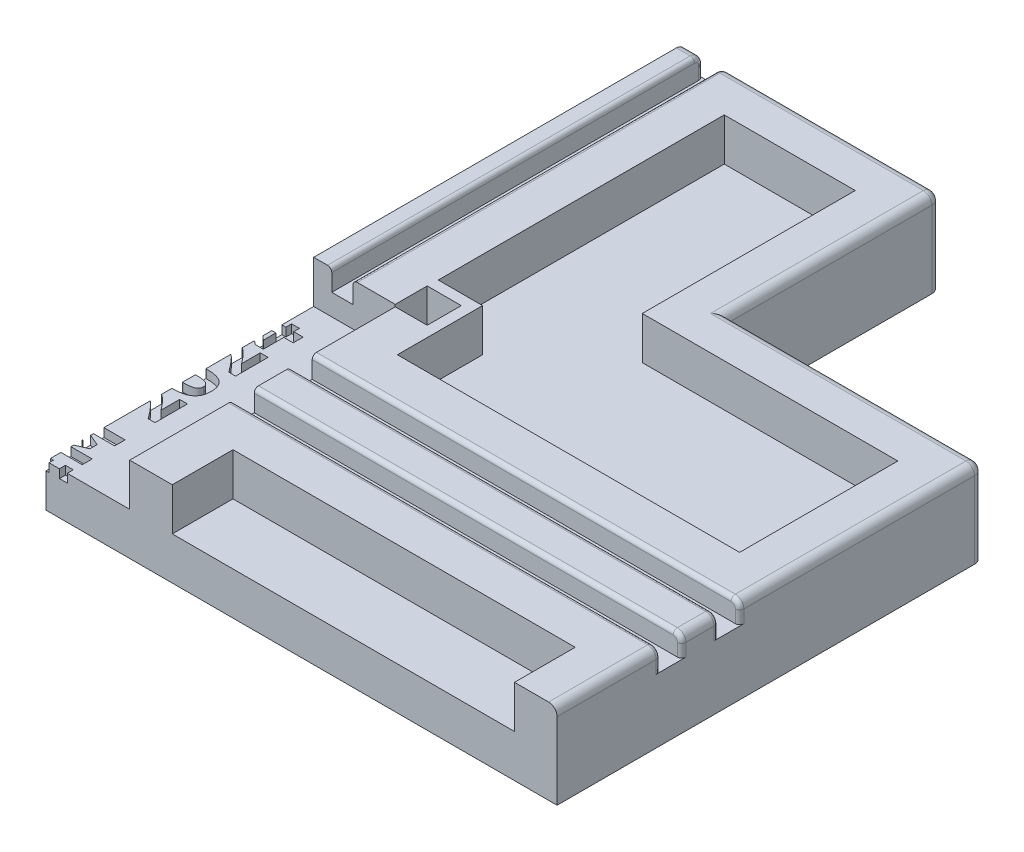
from build123d import *

# Parameters (mm, degrees)
SKETCH1_W                                  = 240
SKETCH1_H                                  = 200
BOSS_EXTRUDE1_DEPTH                        = 20
SKETCH7_W                                  = 120
SKETCH7_H                                  = 50
BOSS_EXTRUDE6_DEPTH                        = 20
FILLET1_R                                  = 2
SKETCH2_W                                  = 39.3
SKETCH2_H                                  = 125.7
CUT_EXTRUDE1_DEPTH                         = 10
CUT_EXTRUDE3_DEPTH                         = 5
MIRROR4_AT_THE_SECOND_PLANE_COPY_1_DEPTH   = 5
SKETCH11_W                                 = 104.748042719
SKETCH11_H                                 = 5
CUT_EXTRUDE4_DEPTH                         = 5
MIRROR6_AT_THE_SECOND_PLANE_COPY_1_SKETC_W = 104.748042719
MIRROR6_AT_THE_SECOND_PLANE_COPY_1_SKETC_H = 5
MIRROR6_AT_THE_SECOND_PLANE_COPY_1_DEPTH   = 5
SHELL1_START                               = 10
SHELL1_OUTLINE_W                           = 80.35
SHELL1_OUTLINE_H                           = 28.5
SHELL1_DEPTH                               = 10
FILLET3_R                                  = 1
SKETCH13_W                                 = 7.252545243
SKETCH13_H                                 = 2.335565418
SKETCH13_W_2                               = 1.720942939
SKETCH13_H_2                               = 2.581414408
CUT_EXTRUDE5_DEPTH                         = 2
CUT_EXTRUDE6_DEPTH                         = 10
MIRROR7_AT_THE_SECOND_PLANE_COPY_1_DEPTH   = 10
SKETCH15_W                                 = 266.75178719
SKETCH15_H                                 = 32.364197877
CUT_EXTRUDE7_DEPTH                         = 194.132079158
SKETCH16_W                                 = 159.450564736
SKETCH16_H                                 = 27.022841001
CUT_EXTRUDE8_DEPTH                         = 194.132079158


# Read off the part's stored shape, not the designer's step: Shell1
with BuildPart() as part:
    # Sketch1 → Boss-Extrude1 (new body)
    with BuildSketch(Plane(origin=(0, 0, 0), x_dir=(1, 0, 0), z_dir=(0, 1, 0))):
        Rectangle(SKETCH1_W, SKETCH1_H)
    extrude(amount=BOSS_EXTRUDE1_DEPTH)

    # Sketch7 → Boss-Extrude6 (add)
    with BuildSketch(Plane(origin=(0, 0, 0), x_dir=(1, 0, 0), z_dir=(0, 1, 0))):
        with Locations((0, 125)):
            Rectangle(SKETCH7_W, SKETCH7_H)
        with Locations((0, -125)):
            Rectangle(SKETCH7_W, SKETCH7_H)
    extrude(amount=BOSS_EXTRUDE6_DEPTH)

    # Fillet1
    fillet1_edges = [part.edges().sort_by_distance(p)[0] for p in [
        (-120, 20, 0),
        (90, 20, 100),
        (-90, 20, 100),
        (-60, 10, 150),
        (60, 10, 150),
        (-60, 20, 125),
        (0, 20, 150),
        (60, 20, 125),
        (-90, 20, -100),
        (60, 20, -125),
        (0, 20, -150),
        (60, 10, -150),
        (-60, 10, -150),
        (-60, 20, -125),
        (120, 20, 0),
        (120, 10, 100),
        (-120, 10, 100),
        (-120, 10, -100),
        (120, 10, -100),
        (90, 20, -100),
    ]]
    fillet(fillet1_edges, radius=FILLET1_R)

    # Sketch2 → Cut-Extrude1 (cut)
    with BuildSketch(Plane(origin=(0, 20, 0), x_dir=(1, 0, 0), z_dir=(0, 1, 0))):
        Rectangle(SKETCH2_W, SKETCH2_H)
    extrude(amount=-CUT_EXTRUDE1_DEPTH, mode=Mode.SUBTRACT)

    # Sketch10 → Cut-Extrude3 (cut)
    with BuildSketch(Plane(origin=(0, 20, 0), x_dir=(1, 0, 0), z_dir=(0, 1, 0))):
        Polygon((-9.25, -40.5), (-9.25, -33.162899401), (-4.25, -33.162899401), (-4.25, -40.5), (-4.25, -156.832928994), (-9.25, -156.832928994), align=None)
    cut_extrude3 = extrude(amount=-CUT_EXTRUDE3_DEPTH, mode=Mode.SUBTRACT)

    # Mirror4: Cut-Extrude3 across plane
    add(cut_extrude3.mirror(Plane(origin=(0, 0, 0), x_dir=(0, 0, 1), z_dir=(1, 0, 0))), mode=Mode.SUBTRACT)

    # Mirror4 at the second plane: Cut-Extrude3 across plane
    add(cut_extrude3.mirror(Plane.XY), mode=Mode.SUBTRACT)

    # Mirror4 at the second plane copy 1 sketc → Mirror4 at the second plane copy 1 (cut)
    with BuildSketch(Plane(origin=(0, 20, 0), x_dir=(-1, 0, 0), z_dir=(0, 1, 0))):
        Polygon((-9.25, -40.5), (-9.25, -33.162899401), (-4.25, -33.162899401), (-4.25, -40.5), (-4.25, -156.832928994), (-9.25, -156.832928994), align=None)
    extrude(amount=-MIRROR4_AT_THE_SECOND_PLANE_COPY_1_DEPTH, mode=Mode.SUBTRACT)

    # Sketch11 → Cut-Extrude4 (cut)
    with BuildSketch(Plane(origin=(0, 20, 0), x_dir=(1, 0, 0), z_dir=(0, 1, 0))):
        with Locations((-72.024021359, 26.75)):
            Rectangle(SKETCH11_W, SKETCH11_H)
        with Locations((-72.024021359, 40.35)):
            Rectangle(SKETCH11_W, SKETCH11_H)
    cut_extrude4 = extrude(amount=-CUT_EXTRUDE4_DEPTH, mode=Mode.SUBTRACT)

    # Mirror6: Cut-Extrude4 across plane
    add(cut_extrude4.mirror(Plane.XY), mode=Mode.SUBTRACT)

    # Mirror6 at the second plane: Cut-Extrude4 across plane
    add(cut_extrude4.mirror(Plane(origin=(0, 0, 0), x_dir=(0, 0, 1), z_dir=(1, 0, 0))), mode=Mode.SUBTRACT)

    # Mirror6 at the second plane copy 1 sketc → Mirror6 at the second plane copy 1 (cut)
    with BuildSketch(Plane(origin=(0, 20, 0), x_dir=(-1, 0, 0), z_dir=(0, 1, 0))):
        with Locations((-72.024021359, 26.75)):
            Rectangle(MIRROR6_AT_THE_SECOND_PLANE_COPY_1_SKETC_W, MIRROR6_AT_THE_SECOND_PLANE_COPY_1_SKETC_H)
        with Locations((-72.024021359, 40.35)):
            Rectangle(MIRROR6_AT_THE_SECOND_PLANE_COPY_1_SKETC_W, MIRROR6_AT_THE_SECOND_PLANE_COPY_1_SKETC_H)
    extrude(amount=-MIRROR6_AT_THE_SECOND_PLANE_COPY_1_DEPTH, mode=Mode.SUBTRACT)

    # Shell1 outline → Shell1 (cut)
    with BuildSketch(Plane(origin=(0, 0, 0), x_dir=(1, 0, 0), z_dir=(0, 1, 0)).offset(SHELL1_START)):
        Polygon((-29.65, 72.85), (-19.25, 72.85), (-19.25, 140), (-50, 140), (-50, 90), (-110, 90), (-110, 52.85), (-29.65, 52.85), align=None)
        Polygon((19.25, 72.85), (29.65, 72.85), (29.65, 52.85), (110, 52.85), (110, 90), (50, 90), (50, 140), (19.25, 140), align=None)
        Polygon((-110, -52.85), (-110, -90), (-50, -90), (-50, -140), (-19.25, -140), (-19.25, -72.85), (-29.65, -72.85), (-29.65, -52.85), align=None)
        with Locations((-69.825, 0)):
            Rectangle(SHELL1_OUTLINE_W, SHELL1_OUTLINE_H)
        Polygon((29.65, -72.85), (19.25, -72.85), (19.25, -140), (50, -140), (50, -90), (110, -90), (110, -52.85), (29.65, -52.85), align=None)
        with Locations((69.825, 0)):
            Rectangle(SHELL1_OUTLINE_W, SHELL1_OUTLINE_H)
    extrude(amount=SHELL1_DEPTH, mode=Mode.SUBTRACT)

    # Fillet3
    fillet3_edges = [part.edges().sort_by_distance(p)[0] for p in [
        (-4.25, 16.5, 150),
        (-4.25, 19.414213562, 149.414213562),
        (-9.25, 16.5, 150),
        (-9.25, 19.414213562, 149.414213562),
        (-4.25, 20, 105.425),
        (-9.25, 20, 105.425),
        (-9.25, 19.414213562, -149.414213562),
        (-9.25, 16.5, -150),
        (-9.25, 20, -105.425),
        (-4.25, 16.5, -150),
        (-4.25, 19.414213562, -149.414213562),
        (-4.25, 20, -105.425),
        (9.25, 16.5, 150),
        (9.25, 20, 105.425),
        (9.25, 19.414213562, 149.414213562),
        (4.25, 16.5, 150),
        (4.25, 19.414213562, 149.414213562),
        (4.25, 20, 105.425),
        (4.25, 16.5, -150),
        (4.25, 19.414213562, -149.414213562),
        (9.25, 19.414213562, -149.414213562),
        (9.25, 16.5, -150),
        (4.25, 20, -105.425),
        (9.25, 20, -105.425),
        (-120, 16.5, -24.25),
        (-120, 16.5, -29.25),
        (-119.414213562, 19.414213562, -24.25),
        (-119.414213562, 19.414213562, -29.25),
        (-68.825, 20, -24.25),
        (-68.825, 20, -29.25),
        (-120, 16.5, -37.85),
        (-120, 16.5, -42.85),
        (-68.825, 20, -37.85),
        (-68.825, 20, -42.85),
        (-119.414213562, 19.414213562, -37.85),
        (-119.414213562, 19.414213562, -42.85),
        (68.825, 20, -29.25),
        (119.414213562, 19.414213562, -29.25),
        (119.414213562, 19.414213562, -24.25),
        (68.825, 20, -24.25),
        (120, 16.5, -29.25),
        (120, 16.5, -24.25),
        (68.825, 20, -42.85),
        (119.414213562, 19.414213562, -42.85),
        (119.414213562, 19.414213562, -37.85),
        (68.825, 20, -37.85),
        (120, 16.5, -42.85),
        (120, 16.5, -37.85),
        (-120, 16.5, 29.25),
        (-120, 16.5, 24.25),
        (-68.825, 20, 29.25),
        (-119.414213562, 19.414213562, 29.25),
        (-119.414213562, 19.414213562, 24.25),
        (-68.825, 20, 24.25),
        (-120, 16.5, 42.85),
        (-120, 16.5, 37.85),
        (-68.825, 20, 42.85),
        (-119.414213562, 19.414213562, 42.85),
        (-119.414213562, 19.414213562, 37.85),
        (-68.825, 20, 37.85),
        (120, 16.5, 24.25),
        (120, 16.5, 29.25),
        (119.414213562, 19.414213562, 24.25),
        (119.414213562, 19.414213562, 29.25),
        (68.825, 20, 24.25),
        (68.825, 20, 29.25),
        (120, 16.5, 37.85),
        (120, 16.5, 42.85),
        (68.825, 20, 37.85),
        (68.825, 20, 42.85),
        (119.414213562, 19.414213562, 37.85),
        (119.414213562, 19.414213562, 42.85),
    ]]
    fillet(fillet3_edges, radius=FILLET3_R)

    # Sketch13 → Cut-Extrude5 (cut)
    # profile 1 of 12: a face of its own
    with BuildSketch(Plane(origin=(0, 10, 0), x_dir=(1, 0, 0), z_dir=(0, 1, 0))):
        Polygon((2.787359078, 56.729654742), (2.787359078, 55.37748529), (5, 55.37748529), (5, 53.041919872), (2.787359078, 53.041919872), (2.787359078, 48.247864542), (0.880108701, 48.247864542), (-4.711035156, 52.886343558), (-4.711035156, 55.37748529), (0.943491644, 55.37748529), (0.943491644, 56.729654742), align=None)
        Polygon((0.943491644, 53.041919872), (-2.596349692, 53.041919872), (0.943491644, 50.110938929), align=None, mode=Mode.SUBTRACT)
    # profile 2 of 12: a face of its own
    with BuildSketch(Plane(origin=(0, 10, 0), x_dir=(1, 0, 0), z_dir=(0, 1, 0))):
        with BuildLine():
            Line((5, 47.141544081), (5, 39.520225351))
            Line((5, 39.520225351), (3.409664338, 39.520225351))
            add(Edge.make_bspline(
                [(3.409664338, 39.520225351), (3.190599668, 39.81675512), (2.747057383, 40.417141716), (2.167094132, 41.14339637), (1.704390868, 41.703253096), (1.381972101, 42.083056551), (1.083256561, 42.417759603), (0.887687077, 42.622007507), (0.79559811, 42.718182933)],
                knots=[0, 0, 0, 0, 1.605452287, 3.25057426, 4.046675402, 4.768563423, 5.420146126, 6, 6, 6, 6], degree=3))
            add(Edge.make_bspline(
                [(0.79559811, 42.718182933), (0.732570292, 42.782561984), (0.609352585, 42.908421315), (0.423765416, 43.085974145), (0.244476812, 43.249198615), (0.074088064, 43.400664381), (-0.092796487, 43.534082219), (-0.252790737, 43.654099684), (-0.406497488, 43.759962438), (-0.599845109, 43.881290453), (-0.837875375, 44.00401532), (-1.125540586, 44.112139625), (-1.412736444, 44.178491494), (-1.604945873, 44.187117789), (-1.699385013, 44.191356186)],
                knots=[0, 0, 0, 0, 1.090093853, 2.131104457, 3.107135244, 4.023908394, 4.888948297, 5.691514549, 6.4435893, 7.146498757, 8.452673016, 9.675803408, 10.85804184, 12, 12, 12, 12], degree=3))
            add(Edge.make_bspline(
                [(-1.699385013, 44.191356186), (-1.754483363, 44.189605987), (-1.861179083, 44.186216799), (-2.017224671, 44.167846758), (-2.162681909, 44.132103765), (-2.300488192, 44.087839319), (-2.42643972, 44.024206924), (-2.544199113, 43.950411254), (-2.650531499, 43.859818439), (-2.749307162, 43.758726543), (-2.834556733, 43.642742478), (-2.911599654, 43.517157005), (-2.971430142, 43.377241787), (-3.024398474, 43.226819474), (-3.063653395, 43.063897589), (-3.092633036, 42.889340485), (-3.109905835, 42.703165878), (-3.111960528, 42.574807759), (-3.113016713, 42.508827152)],
                knots=[0, 0, 0, 0, 1.058578686, 2.049894692, 3.010224385, 3.931750511, 4.822578239, 5.71281177, 6.594427321, 7.498813824, 8.420995957, 9.353043897, 10.321837571, 11.3367408, 12.413304787, 13.535187771, 14.732999458, 16, 16, 16, 16], degree=3))
            add(Edge.make_bspline(
                [(-3.113016713, 42.508827152), (-3.110052719, 42.405568465), (-3.104041103, 42.196137688), (-3.053985994, 41.878413923), (-2.980602684, 41.552282773), (-2.873221808, 41.222921491), (-2.74714341, 40.895094854), (-2.596251992, 40.578640505), (-2.438170844, 40.269132893), (-2.314289691, 40.074405983), (-2.252545243, 39.977350819)],
                knots=[0, 0, 0, 0, 0.914703558, 1.855215137, 2.844920106, 3.875005138, 4.922433174, 5.955639304, 6.981056277, 8, 8, 8, 8], degree=3))
            Line((-2.252545243, 39.977350819), (-2.252545243, 39.766074342))
            Line((-2.252545243, 39.766074342), (-4.363389317, 39.766074342))
            add(Edge.make_bspline(
                [(-4.363389317, 39.766074342), (-4.396975153, 39.85152697), (-4.470639347, 40.038951181), (-4.568658946, 40.352153969), (-4.66491051, 40.720660415), (-4.763825821, 41.132864511), (-4.849735205, 41.573321973), (-4.910075419, 42.024211578), (-4.95119256, 42.474770211), (-4.954991729, 42.775713815), (-4.956884148, 42.92561802)],
                knots=[0, 0, 0, 0, 0.681686624, 1.495150967, 2.435076171, 3.509887788, 4.642826517, 5.765734475, 6.887081194, 8, 8, 8, 8], degree=3))
            add(Edge.make_bspline(
                [(-4.956884148, 42.92561802), (-4.954912362, 43.072306092), (-4.951074185, 43.357841566), (-4.914531776, 43.772464491), (-4.853049644, 44.160650299), (-4.769612134, 44.521836328), (-4.662431161, 44.856562797), (-4.529987596, 45.163893905), (-4.371768891, 45.443672956), (-4.191325, 45.69718541), (-3.986517109, 45.920499957), (-3.762299213, 46.116633841), (-3.516918106, 46.283180062), (-3.250583577, 46.417510178), (-2.964907945, 46.521931142), (-2.659732708, 46.596780352), (-2.333869778, 46.641015432), (-2.109911454, 46.646854566), (-1.995172081, 46.649846099)],
                knots=[0, 0, 0, 0, 1.302669921, 2.535710425, 3.693104205, 4.791067539, 5.825099944, 6.810730835, 7.758000335, 8.67487823, 9.568447078, 10.443087854, 11.315285082, 12.19521531, 13.085757283, 14.011200708, 14.981089066, 16, 16, 16, 16], degree=3))
            add(Edge.make_bspline(
                [(-1.995172081, 46.649846099), (-1.918295051, 46.648245135), (-1.764899121, 46.645050664), (-1.536586701, 46.623146341), (-1.311198259, 46.589276583), (-1.089189633, 46.538876948), (-0.870129482, 46.472993238), (-0.653296175, 46.39436831), (-0.439122967, 46.302496277), (-0.229338943, 46.193054838), (-0.018163961, 46.072147599), (0.191952814, 45.932794317), (0.405837655, 45.781094454), (0.620958688, 45.614342324), (0.835471411, 45.430057751), (1.055741697, 45.23549192), (1.273520634, 45.021368665), (1.417594688, 44.872241147), (1.490889788, 44.796375188)],
                knots=[0, 0, 0, 0, 0.907170522, 1.810115022, 2.704515666, 3.595334857, 4.494160497, 5.402400165, 6.316123003, 7.242010315, 8.19323076, 9.186549597, 10.215937183, 11.28746875, 12.397107329, 13.552885457, 14.755074217, 16, 16, 16, 16], degree=3))
            add(Edge.make_bspline(
                [(1.490889788, 44.796375188), (1.669671754, 44.600991906), (2.021428479, 44.216571794), (2.422503942, 43.720261203), (2.710127438, 43.347225494), (2.892573427, 43.11547907), (3.035611297, 42.923413887), (3.11966375, 42.809753418), (3.156132565, 42.760438229)],
                knots=[0, 0, 0, 0, 1.811045763, 3.563265038, 4.362127914, 5.033096026, 5.580478129, 6, 6, 6, 6], degree=3))
            Line((3.156132565, 42.760438229), (3.156132565, 47.141544081))
            Line((3.156132565, 47.141544081), (5, 47.141544081))
        make_face()
    # profile 3 of 12: a face of its own
    with BuildSketch(Plane(origin=(0, 10, 0), x_dir=(1, 0, 0), z_dir=(0, 1, 0))):
        with BuildLine():
            add(Edge.make_bspline(
                [(0.138720336, 37.553433421), (0.339837036, 37.551198694), (0.731017162, 37.546852061), (1.301575539, 37.503210957), (1.839727263, 37.435290008), (2.344336806, 37.340402007), (2.812295891, 37.218717557), (3.235819492, 37.059739443), (3.620265586, 36.877229499), (3.845547684, 36.720963882), (3.955141787, 36.64494457)],
                knots=[0, 0, 0, 0, 1.210994604, 2.355433537, 3.443919748, 4.476135166, 5.446013627, 6.351277171, 7.197937607, 8, 8, 8, 8], degree=3))
            add(Edge.make_bspline(
                [(3.955141787, 36.64494457), (4.057367971, 36.5617232), (4.260610648, 36.396265258), (4.524020765, 36.101981434), (4.745368417, 35.772676286), (4.897303004, 35.472877401), (4.999247268, 35.217133399), (5.063592063, 35.011802969), (5.122267484, 34.796985151), (5.167723638, 34.570405454), (5.201934481, 34.333084121), (5.226664862, 34.085073274), (5.242295446, 33.825562266), (5.244648027, 33.648682389), (5.245848991, 33.558387312)],
                knots=[0, 0, 0, 0, 1.363120718, 2.710110989, 4.070537742, 5.460816644, 6.180869889, 6.918733188, 7.687278466, 8.485437086, 9.309407483, 10.168795045, 11.065191617, 12, 12, 12, 12], degree=3))
            add(Edge.make_bspline(
                [(5.245848991, 33.558387312), (5.241905689, 33.384062955), (5.234297073, 33.047703496), (5.173081199, 32.562988904), (5.069699732, 32.118069919), (4.926806373, 31.711596248), (4.739854178, 31.34454147), (4.516760058, 31.013155063), (4.251279595, 30.717979546), (4.045332533, 30.554230832), (3.94169692, 30.471830054)],
                knots=[0, 0, 0, 0, 1.200851745, 2.317047666, 3.359233085, 4.342911255, 5.278031965, 6.189548012, 7.088953741, 8, 8, 8, 8], degree=3))
            add(Edge.make_bspline(
                [(3.94169692, 30.471830054), (3.829424185, 30.3947628), (3.600170882, 30.2373967), (3.214838014, 30.049115343), (2.792701976, 29.89168932), (2.331256748, 29.768085058), (1.834031119, 29.675388633), (1.301418942, 29.61187027), (0.734794995, 29.570336966), (0.344952566, 29.565716964), (0.144482422, 29.563341204)],
                knots=[0, 0, 0, 0, 0.822750793, 1.680001256, 2.58557045, 3.544707477, 4.565467581, 5.642347189, 6.787615291, 8, 8, 8, 8], degree=3))
            add(Edge.make_bspline(
                [(0.144482422, 29.563341204), (-0.061754837, 29.565532126), (-0.459970452, 29.569762495), (-1.036345286, 29.613069323), (-1.570746564, 29.680774054), (-2.065452333, 29.775711056), (-2.521358164, 29.900947264), (-2.938473361, 30.06222162), (-3.323134476, 30.249194002), (-3.55325365, 30.406272972), (-3.666176943, 30.483354226)],
                knots=[0, 0, 0, 0, 1.242237956, 2.39858964, 3.479780431, 4.485821505, 5.430991799, 6.32348679, 7.177307181, 8, 8, 8, 8], degree=3))
            add(Edge.make_bspline(
                [(-3.666176943, 30.483354226), (-3.769193286, 30.566416838), (-3.974708441, 30.732124775), (-4.238285133, 31.029639616), (-4.461065672, 31.362253167), (-4.645070962, 31.729678272), (-4.784115122, 32.135791847), (-4.885860052, 32.577168574), (-4.944671996, 33.056148657), (-4.952723667, 33.387282789), (-4.956884148, 33.558387312)],
                knots=[0, 0, 0, 0, 0.915406887, 1.826214983, 2.74012738, 3.682217607, 4.664024873, 5.706462388, 6.814877053, 8, 8, 8, 8], degree=3))
            add(Edge.make_bspline(
                [(-4.956884148, 33.558387312), (-4.955682618, 33.64868302), (-4.953320425, 33.826203271), (-4.937576888, 34.086978277), (-4.913381513, 34.337057391), (-4.877300412, 34.575699285), (-4.828262853, 34.80214551), (-4.773499009, 35.018778584), (-4.706561244, 35.224310597), (-4.601886899, 35.480626422), (-4.447267393, 35.781827029), (-4.217150947, 36.109134402), (-3.948246131, 36.405401156), (-3.739143401, 36.569659884), (-3.633525124, 36.652627351)],
                knots=[0, 0, 0, 0, 0.927772364, 1.823989051, 2.683453821, 3.508702832, 4.302191287, 5.063276402, 5.803871599, 6.520953588, 7.906777029, 9.27188215, 10.622021304, 12, 12, 12, 12], degree=3))
            add(Edge.make_bspline(
                [(-3.633525124, 36.652627351), (-3.521300204, 36.729189524), (-3.292789343, 36.885084383), (-2.908970475, 37.068290297), (-2.492360426, 37.225455121), (-2.036263275, 37.346342452), (-1.54437137, 37.439204828), (-1.015826808, 37.505677425), (-0.450933502, 37.546286922), (-0.061742996, 37.551003841), (0.138720336, 37.553433421)],
                knots=[0, 0, 0, 0, 0.826423845, 1.682753026, 2.582377666, 3.535958882, 4.552416628, 5.629628825, 6.779074777, 8, 8, 8, 8], degree=3))
        make_face()
        with BuildLine():
            add(Edge.make_bspline(
                [(0.138720336, 35.094943508), (-0.002794049, 35.093990238), (-0.275052116, 35.092156251), (-0.667644343, 35.074004214), (-1.028464631, 35.048543297), (-1.357952356, 35.010483072), (-1.656192237, 34.961169576), (-1.923473104, 34.900935006), (-2.158488294, 34.828227196), (-2.363936988, 34.745989678), (-2.54162794, 34.64913888), (-2.69467252, 34.537908006), (-2.823572221, 34.410664927), (-2.931286275, 34.270097317), (-3.011274034, 34.111739825), (-3.072443859, 33.941187009), (-3.106785969, 33.754382189), (-3.110895684, 33.625106618), (-3.113016713, 33.558387312)],
                knots=[0, 0, 0, 0, 1.684598718, 3.240982106, 4.677870026, 5.990101975, 7.188004416, 8.275163324, 9.249099904, 10.113910365, 10.905306099, 11.652292794, 12.358339015, 13.054983843, 13.750418457, 14.461547751, 15.206002611, 16, 16, 16, 16], degree=3))
            add(Edge.make_bspline(
                [(-3.113016713, 33.558387312), (-3.110895681, 33.491668012), (-3.106785962, 33.362392453), (-3.072443884, 33.175587552), (-3.011273943, 33.005035023), (-2.931286606, 32.84667649), (-2.823570979, 32.706112772), (-2.694677343, 32.578854684), (-2.541608299, 32.467684345), (-2.363496496, 32.37029911), (-2.157013742, 32.289020864), (-1.921590867, 32.215742751), (-1.654258135, 32.155647372), (-1.355414385, 32.106122047), (-1.024612933, 32.068276855), (-0.661244964, 32.04269777), (-0.266085327, 32.024665897), (0.008090715, 32.022799039), (0.150244508, 32.021831116)],
                knots=[0, 0, 0, 0, 0.791766581, 1.534129826, 2.243261137, 2.936741863, 3.631429404, 4.335491923, 5.08037989, 5.869552125, 6.738971147, 7.710171362, 8.794275798, 9.988812621, 11.304907075, 12.745337551, 14.312534512, 16, 16, 16, 16], degree=3))
            add(Edge.make_bspline(
                [(0.150244508, 32.021831116), (0.289201434, 32.022765136), (0.556986265, 32.024565091), (0.943773412, 32.043063349), (1.30096878, 32.067483158), (1.627502144, 32.109075315), (1.924420257, 32.156514098), (2.190195476, 32.220950105), (2.427221865, 32.292197549), (2.635687527, 32.376524358), (2.816464841, 32.475577579), (2.974492505, 32.586386469), (3.106149375, 32.714997304), (3.215613674, 32.855867424), (3.298888327, 33.012083539), (3.358752163, 33.181622444), (3.396338685, 33.365314373), (3.400067537, 33.492898418), (3.401981557, 33.558387312)],
                knots=[0, 0, 0, 0, 1.658832269, 3.196746878, 4.622488866, 5.931787449, 7.125569234, 8.210133994, 9.194149195, 10.078471196, 10.889203548, 11.650697572, 12.375032472, 13.07829054, 13.77251817, 14.478471121, 15.218999177, 16, 16, 16, 16], degree=3))
            add(Edge.make_bspline(
                [(3.401981557, 33.558387312), (3.400068186, 33.623876875), (3.3963406, 33.751462223), (3.358745104, 33.935144911), (3.298913291, 34.10471679), (3.215521541, 34.260812329), (3.106775331, 34.40178813), (2.97377315, 34.528364287), (2.816557237, 34.639341559), (2.635707586, 34.738476019), (2.42683161, 34.821967534), (2.190341985, 34.897522561), (1.921851262, 34.956560743), (1.624132619, 35.009519497), (1.295502071, 35.045529443), (0.936895825, 35.074962985), (0.547988509, 35.091838226), (0.278306115, 35.093884415), (0.138720336, 35.094943508)],
                knots=[0, 0, 0, 0, 0.778971247, 1.517574904, 2.221693305, 2.914116855, 3.615547377, 4.332711038, 5.092226179, 5.900851692, 6.782875619, 7.766611013, 8.854037796, 10.053520173, 11.366075456, 12.788704916, 14.337855446, 16, 16, 16, 16], degree=3))
        make_face(mode=Mode.SUBTRACT)
    # profile 4 of 12: a face of its own
    with BuildSketch(Plane(origin=(0, 10, 0), x_dir=(1, 0, 0), z_dir=(0, 1, 0))):
        with BuildLine():
            Line((5, 28.211171751), (5, 20.589853021))
            Line((5, 20.589853021), (3.409664338, 20.589853021))
            add(Edge.make_bspline(
                [(3.409664338, 20.589853021), (3.190599668, 20.88638279), (2.747057383, 21.486769386), (2.167094132, 22.21302404), (1.704390868, 22.772880767), (1.381972101, 23.152684221), (1.083256561, 23.487387273), (0.887687077, 23.691635177), (0.79559811, 23.787810603)],
                knots=[0, 0, 0, 0, 1.605452287, 3.25057426, 4.046675402, 4.768563423, 5.420146126, 6, 6, 6, 6], degree=3))
            add(Edge.make_bspline(
                [(0.79559811, 23.787810603), (0.732570292, 23.852189654), (0.609352585, 23.978048985), (0.423765416, 24.155601815), (0.244476812, 24.318826285), (0.074088064, 24.470292051), (-0.092796487, 24.60370989), (-0.252790737, 24.723727355), (-0.406497488, 24.829590108), (-0.599845109, 24.950918123), (-0.837875375, 25.07364299), (-1.125540586, 25.181767295), (-1.412736444, 25.248119164), (-1.604945873, 25.256745459), (-1.699385013, 25.260983856)],
                knots=[0, 0, 0, 0, 1.090093853, 2.131104457, 3.107135244, 4.023908394, 4.888948297, 5.691514549, 6.4435893, 7.146498757, 8.452673016, 9.675803408, 10.85804184, 12, 12, 12, 12], degree=3))
            add(Edge.make_bspline(
                [(-1.699385013, 25.260983856), (-1.754483363, 25.259233658), (-1.861179083, 25.25584447), (-2.017224671, 25.237474428), (-2.162681909, 25.201731435), (-2.300488192, 25.157466989), (-2.42643972, 25.093834595), (-2.544199113, 25.020038924), (-2.650531499, 24.929446109), (-2.749307162, 24.828354213), (-2.834556733, 24.712370148), (-2.911599654, 24.586784675), (-2.971430142, 24.446869457), (-3.024398474, 24.296447144), (-3.063653395, 24.133525259), (-3.092633036, 23.958968155), (-3.109905835, 23.772793548), (-3.111960528, 23.644435429), (-3.113016713, 23.578454822)],
                knots=[0, 0, 0, 0, 1.058578686, 2.049894692, 3.010224385, 3.931750511, 4.822578239, 5.71281177, 6.594427321, 7.498813824, 8.420995957, 9.353043897, 10.321837571, 11.3367408, 12.413304787, 13.535187771, 14.732999458, 16, 16, 16, 16], degree=3))
            add(Edge.make_bspline(
                [(-3.113016713, 23.578454822), (-3.110052719, 23.475196136), (-3.104041103, 23.265765358), (-3.053985994, 22.948041593), (-2.980602684, 22.621910443), (-2.873221808, 22.292549161), (-2.74714341, 21.964722525), (-2.596251992, 21.648268175), (-2.438170844, 21.338760563), (-2.314289691, 21.144033653), (-2.252545243, 21.046978489)],
                knots=[0, 0, 0, 0, 0.914703558, 1.855215137, 2.844920106, 3.875005138, 4.922433174, 5.955639304, 6.981056277, 8, 8, 8, 8], degree=3))
            Line((-2.252545243, 21.046978489), (-2.252545243, 20.835702012))
            Line((-2.252545243, 20.835702012), (-4.363389317, 20.835702012))
            add(Edge.make_bspline(
                [(-4.363389317, 20.835702012), (-4.396975153, 20.92115464), (-4.470639347, 21.108578851), (-4.568658946, 21.421781639), (-4.66491051, 21.790288086), (-4.763825821, 22.202492181), (-4.849735205, 22.642949643), (-4.910075419, 23.093839248), (-4.95119256, 23.544397881), (-4.954991729, 23.845341485), (-4.956884148, 23.99524569)],
                knots=[0, 0, 0, 0, 0.681686624, 1.495150967, 2.435076171, 3.509887788, 4.642826517, 5.765734475, 6.887081194, 8, 8, 8, 8], degree=3))
            add(Edge.make_bspline(
                [(-4.956884148, 23.99524569), (-4.954912362, 24.141933762), (-4.951074185, 24.427469237), (-4.914531776, 24.842092162), (-4.853049644, 25.230277969), (-4.769612134, 25.591463998), (-4.662431161, 25.926190468), (-4.529987596, 26.233521576), (-4.371768891, 26.513300626), (-4.191325, 26.76681308), (-3.986517109, 26.990127627), (-3.762299213, 27.186261512), (-3.516918106, 27.352807733), (-3.250583577, 27.487137848), (-2.964907945, 27.591558812), (-2.659732708, 27.666408023), (-2.333869778, 27.710643103), (-2.109911454, 27.716482236), (-1.995172081, 27.719473769)],
                knots=[0, 0, 0, 0, 1.302669921, 2.535710425, 3.693104205, 4.791067539, 5.825099944, 6.810730835, 7.758000335, 8.67487823, 9.568447078, 10.443087854, 11.315285082, 12.19521531, 13.085757283, 14.011200708, 14.981089066, 16, 16, 16, 16], degree=3))
            add(Edge.make_bspline(
                [(-1.995172081, 27.719473769), (-1.918295051, 27.717872805), (-1.764899121, 27.714678334), (-1.536586701, 27.692774011), (-1.311198259, 27.658904253), (-1.089189633, 27.608504619), (-0.870129482, 27.542620908), (-0.653296175, 27.46399598), (-0.439122967, 27.372123947), (-0.229338943, 27.262682508), (-0.018163961, 27.141775269), (0.191952814, 27.002421987), (0.405837655, 26.850722124), (0.620958688, 26.683969994), (0.835471411, 26.499685422), (1.055741697, 26.30511959), (1.273520634, 26.090996335), (1.417594688, 25.941868817), (1.490889788, 25.866002858)],
                knots=[0, 0, 0, 0, 0.907170522, 1.810115022, 2.704515666, 3.595334857, 4.494160497, 5.402400165, 6.316123003, 7.242010315, 8.19323076, 9.186549597, 10.215937183, 11.28746875, 12.397107329, 13.552885457, 14.755074217, 16, 16, 16, 16], degree=3))
            add(Edge.make_bspline(
                [(1.490889788, 25.866002858), (1.669671754, 25.670619576), (2.021428479, 25.286199464), (2.422503942, 24.789888873), (2.710127438, 24.416853164), (2.892573427, 24.18510674), (3.035611297, 23.993041557), (3.11966375, 23.879381088), (3.156132565, 23.830065899)],
                knots=[0, 0, 0, 0, 1.811045763, 3.563265038, 4.362127914, 5.033096026, 5.580478129, 6, 6, 6, 6], degree=3))
            Line((3.156132565, 23.830065899), (3.156132565, 28.211171751))
            Line((3.156132565, 28.211171751), (5, 28.211171751))
        make_face()
    # profile 5 of 12: a face of its own
    with BuildSketch(Plane(origin=(0, 10, 0), x_dir=(1, 0, 0), z_dir=(0, 1, 0))):
        Polygon((5, 13.583156769), (5, 11.124666856), (-1.524601746, 11.124666856), (2.664434583, 9.338420279), (2.664434583, 7.625160121), (-1.524601746, 5.838913543), (5, 5.838913543), (5, 3.503348126), (-4.711035156, 3.503348126), (-4.711035156, 6.382470298), (0.125275469, 8.549014533), (-4.711035156, 10.709796683), (-4.711035156, 13.583156769), align=None)
    # profile 6 of 12: a face of its own
    with BuildSketch(Plane(origin=(0, 10, 0), x_dir=(1, 0, 0), z_dir=(0, 1, 0))):
        Polygon((5, 1.4136317), (5, -5.593064552), (-4.711035156, -5.593064552), (-4.711035156, 1.4136317), (-2.867167722, 1.4136317), (-2.867167722, -3.134574639), (-1.146224782, -3.134574639), (-1.146224782, 1.044858213), (0.697642652, 1.044858213), (0.697642652, -3.134574639), (3.156132565, -3.134574639), (3.156132565, 1.4136317), align=None)
    # profile 7 of 12: a face of its own
    with BuildSketch(Plane(origin=(0, 10, 0), x_dir=(1, 0, 0), z_dir=(0, 1, 0))):
        with BuildLine():
            add(Edge.make_bspline(
                [(4.475650198, -7.805705474), (4.519354839, -7.923859504), (4.612512661, -8.17570855), (4.743574124, -8.583890089), (4.866671289, -9.047274178), (4.996208031, -9.552124696), (5.106381276, -10.084227717), (5.187397941, -10.625264318), (5.237323662, -11.165972628), (5.243010567, -11.526628491), (5.245848991, -11.706637515)],
                knots=[0, 0, 0, 0, 0.756485239, 1.612472169, 2.573171414, 3.635272123, 4.742182008, 5.834553763, 6.919191659, 8, 8, 8, 8], degree=3))
            add(Edge.make_bspline(
                [(5.245848991, -11.706637515), (5.241962961, -11.909112321), (5.234392087, -12.303579456), (5.17063924, -12.878829296), (5.062937634, -13.419584917), (4.916847086, -13.928231287), (4.72267015, -14.400885619), (4.491042888, -14.842463027), (4.211679163, -15.247896521), (3.893490591, -15.618759753), (3.53655883, -15.9505899), (3.145758166, -16.239699566), (2.72146993, -16.48347792), (2.264846611, -16.681095463), (1.776896349, -16.838089964), (1.255150105, -16.944841813), (0.702111097, -17.014888699), (0.322052776, -17.021601157), (0.127196165, -17.025042647)],
                knots=[0, 0, 0, 0, 1.160705024, 2.261318311, 3.313123859, 4.319096107, 5.290496718, 6.238021168, 7.172737693, 8.107230733, 9.03451477, 9.961071912, 10.888559376, 11.833805606, 12.808979065, 13.821966168, 14.883317984, 16, 16, 16, 16], degree=3))
            add(Edge.make_bspline(
                [(0.127196165, -17.025042647), (-0.058682323, -17.02067815), (-0.422730133, -17.012130168), (-0.955049114, -16.943336637), (-1.460067022, -16.832867692), (-1.937766829, -16.677677821), (-2.386372436, -16.473696921), (-2.808700267, -16.227656485), (-3.203463564, -15.935836699), (-3.565000576, -15.598836264), (-3.895700628, -15.226075236), (-4.177610929, -14.810267907), (-4.422741814, -14.363406013), (-4.616779655, -13.8775432), (-4.772219277, -13.359136807), (-4.876169413, -12.804694831), (-4.946971316, -12.216810998), (-4.953520434, -11.812500101), (-4.956884148, -11.604840667)],
                knots=[0, 0, 0, 0, 1.061573339, 2.079118747, 3.060574866, 4.011305467, 4.942696719, 5.870461571, 6.798745348, 7.740825567, 8.68941507, 9.638984161, 10.604583371, 11.595514188, 12.621960228, 13.691449096, 14.814297672, 16, 16, 16, 16], degree=3))
            add(Edge.make_bspline(
                [(-4.956884148, -11.604840667), (-4.954318925, -11.445386322), (-4.949235323, -11.129389392), (-4.919388643, -10.661251886), (-4.863951384, -10.205248288), (-4.792453594, -9.753475749), (-4.684946461, -9.294730481), (-4.534849919, -8.818874824), (-4.346707534, -8.316660693), (-4.193287983, -7.980233106), (-4.113698935, -7.805705474)],
                knots=[0, 0, 0, 0, 0.974479143, 1.931163549, 2.86485946, 3.780778834, 4.725046501, 5.741022375, 6.828116267, 8, 8, 8, 8], degree=3))
            Line((-4.113698935, -7.805705474), (-1.883771756, -7.805705474))
            Line((-1.883771756, -7.805705474), (-1.883771756, -8.091889065))
            add(Edge.make_bspline(
                [(-1.883771756, -8.091889065), (-1.906716104, -8.126531064), (-1.957410079, -8.203070203), (-2.043059993, -8.326945943), (-2.137489474, -8.476111594), (-2.284548962, -8.694884397), (-2.45960062, -8.978067997), (-2.581693909, -9.213466955), (-2.640525683, -9.326896107)],
                knots=[0, 0, 0, 0, 0.515980687, 1.140024195, 1.869947604, 2.707876564, 4.413660046, 6, 6, 6, 6], degree=3))
            add(Edge.make_bspline(
                [(-2.640525683, -9.326896107), (-2.672756546, -9.393740863), (-2.73882048, -9.530753251), (-2.823836627, -9.749019276), (-2.905177649, -9.981830174), (-2.978097, -10.22950925), (-3.037034138, -10.489919732), (-3.082413494, -10.759686706), (-3.106467195, -11.03779789), (-3.110821171, -11.225783758), (-3.113016713, -11.320577771)],
                knots=[0, 0, 0, 0, 0.861448091, 1.765719082, 2.717953576, 3.724891765, 4.761927522, 5.816719679, 6.89905606, 8, 8, 8, 8], degree=3))
            add(Edge.make_bspline(
                [(-3.113016713, -11.320577771), (-3.110164997, -11.430782772), (-3.104578279, -11.646682304), (-3.068710383, -11.963218824), (-3.004292393, -12.263584213), (-2.918860854, -12.549882667), (-2.805175217, -12.820581595), (-2.662381265, -13.075068024), (-2.499039638, -13.320076357), (-2.36711736, -13.466852812), (-2.300562624, -13.540901474)],
                knots=[0, 0, 0, 0, 1.091217493, 2.137773647, 3.148547478, 4.129133693, 5.092188092, 6.048375109, 7.015406034, 8, 8, 8, 8], degree=3))
            add(Edge.make_bspline(
                [(-2.300562624, -13.540901474), (-2.231129169, -13.608753509), (-2.090799964, -13.745886571), (-1.846186727, -13.91943259), (-1.579009792, -14.07619004), (-1.283734201, -14.208811415), (-0.962723927, -14.314570988), (-0.616833633, -14.387928819), (-0.248028071, -14.435679856), (0.006035391, -14.440927383), (0.136799641, -14.443628239)],
                knots=[0, 0, 0, 0, 0.871242595, 1.760833901, 2.686460846, 3.652134751, 4.663748384, 5.717797841, 6.825370436, 8, 8, 8, 8], degree=3))
            add(Edge.make_bspline(
                [(0.136799641, -14.443628239), (0.270078203, -14.441217619), (0.528956778, -14.436535262), (0.904701948, -14.395518364), (1.257245759, -14.329288021), (1.585144219, -14.233472949), (1.889752999, -14.11198958), (2.170660406, -13.964565335), (2.424839249, -13.78559248), (2.657673098, -13.584235453), (2.862193118, -13.352834409), (3.041867765, -13.096983341), (3.191530728, -12.813783401), (3.315763592, -12.506455713), (3.407777269, -12.172177215), (3.477785429, -11.813452581), (3.51753353, -11.428392977), (3.522401475, -11.163169785), (3.524906052, -11.026711399)],
                knots=[0, 0, 0, 0, 1.162877018, 2.258757441, 3.29433279, 4.289818334, 5.235063129, 6.152415668, 7.05144509, 7.94239879, 8.832861761, 9.739671241, 10.664582224, 11.622279774, 12.626959197, 13.685538709, 14.809200461, 16, 16, 16, 16], degree=3))
            add(Edge.make_bspline(
                [(3.524906052, -11.026711399), (3.524545414, -10.976125561), (3.523787414, -10.869802624), (3.51698298, -10.707868976), (3.511542352, -10.544994826), (3.50110347, -10.438303115), (3.496095624, -10.387119882)],
                knots=[0, 0, 0, 0, 0.947728294, 1.991965744, 3.036685378, 4, 4, 4, 4], degree=3))
            Line((3.496095624, -10.387119882), (1.435189626, -10.387119882))
            Line((1.435189626, -10.387119882), (1.435189626, -12.353911813))
            Line((1.435189626, -12.353911813), (-0.408677809, -12.353911813))
            Line((-0.408677809, -12.353911813), (-0.408677809, -7.805705474))
            Line((-0.408677809, -7.805705474), (4.475650198, -7.805705474))
        make_face()
    # profile 8 of 12: a face of its own
    with BuildSketch(Plane(origin=(0, 10, 0), x_dir=(1, 0, 0), z_dir=(0, 1, 0))):
        with Locations((1.373727378, -19.913768295)):
            Rectangle(SKETCH13_W, SKETCH13_H)
    # profile 9 of 12: a face of its own
    with BuildSketch(Plane(origin=(0, 10, 0), x_dir=(1, 0, 0), z_dir=(0, 1, 0))):
        with Locations((-4.219337174, -19.913768295)):
            Rectangle(SKETCH13_W_2, SKETCH13_H_2)
    # profile 10 of 12: a face of its own
    with BuildSketch(Plane(origin=(0, 10, 0), x_dir=(1, 0, 0), z_dir=(0, 1, 0))):
        with BuildLine():
            add(Edge.make_bspline(
                [(5.245848991, -30.773379208), (5.241556228, -30.949600555), (5.233101922, -31.296656552), (5.17328717, -31.807137753), (5.071443943, -32.296870987), (4.929457053, -32.76358831), (4.750483589, -33.205121013), (4.527408056, -33.614715808), (4.267338932, -33.994815031), (4.061606502, -34.220067298), (3.958983177, -34.332427496)],
                knots=[0, 0, 0, 0, 1.089850102, 2.146385891, 3.173869964, 4.179760968, 5.160008291, 6.115072822, 7.059761785, 8, 8, 8, 8], degree=3))
            add(Edge.make_bspline(
                [(3.958983177, -34.332427496), (3.848038568, -34.438295465), (3.624492228, -34.651612698), (3.240912088, -34.92404395), (2.819806379, -35.161121156), (2.440058042, -35.326067869), (2.118408243, -35.437370727), (1.865302565, -35.510926057), (1.602961267, -35.571890876), (1.331038558, -35.621175666), (1.050675199, -35.662875321), (0.76008365, -35.687900337), (0.460358885, -35.70657835), (0.257194686, -35.708560179), (0.154085898, -35.709565986)],
                knots=[0, 0, 0, 0, 1.326589366, 2.672993315, 4.060770367, 5.505883836, 6.25107509, 7.007321983, 7.7873399, 8.582269437, 9.400071632, 10.240855478, 11.107208546, 12, 12, 12, 12], degree=3))
            add(Edge.make_bspline(
                [(0.154085898, -35.709565986), (-0.036260272, -35.705853317), (-0.409159179, -35.698579988), (-0.954067146, -35.631518817), (-1.472101576, -35.524248732), (-1.962272567, -35.375865598), (-2.421254864, -35.182794221), (-2.847342954, -34.951680217), (-3.242424741, -34.683652344), (-3.47520079, -34.471076121), (-3.591269829, -34.365079315)],
                knots=[0, 0, 0, 0, 1.119324668, 2.1928203, 3.223958197, 4.228260008, 5.200520162, 6.147632129, 7.076354466, 8, 8, 8, 8], degree=3))
            add(Edge.make_bspline(
                [(-3.591269829, -34.365079315), (-3.696426816, -34.256022231), (-3.907914238, -34.036691095), (-4.17855444, -33.660997219), (-4.413868173, -33.249571895), (-4.610724175, -32.802820982), (-4.765892728, -32.325941651), (-4.877010675, -31.82562766), (-4.943259501, -31.303347455), (-4.952287649, -30.948354573), (-4.956884148, -30.767617122)],
                knots=[0, 0, 0, 0, 0.919195442, 1.8486482, 2.803167129, 3.793795735, 4.808307604, 5.844199062, 6.902417522, 8, 8, 8, 8], degree=3))
            add(Edge.make_bspline(
                [(-4.956884148, -30.767617122), (-4.956393428, -30.668359933), (-4.955436829, -30.474869682), (-4.94084827, -30.191814102), (-4.921289403, -29.923828157), (-4.879474294, -29.592200908), (-4.814808823, -29.204474119), (-4.7421777, -28.904822537), (-4.707193766, -28.760490591)],
                knots=[0, 0, 0, 0, 0.880714095, 1.716848845, 2.514717796, 3.264532192, 4.682418473, 6, 6, 6, 6], degree=3))
            add(Edge.make_bspline(
                [(-4.707193766, -28.760490591), (-4.664108705, -28.621612355), (-4.581310973, -28.354726269), (-4.434982607, -27.98111963), (-4.28414942, -27.652264541), (-4.186257609, -27.446632632), (-4.140588669, -27.350700282)],
                knots=[0, 0, 0, 0, 1.146660616, 2.203568899, 3.161920647, 4, 4, 4, 4], degree=3))
            Line((-4.140588669, -27.350700282), (-1.760847261, -27.350700282))
            Line((-1.760847261, -27.350700282), (-1.760847261, -27.636883873))
            add(Edge.make_bspline(
                [(-1.760847261, -27.636883873), (-1.789760882, -27.669445598), (-1.850028949, -27.737317837), (-1.943169449, -27.84646079), (-2.044289807, -27.966859077), (-2.193791638, -28.146156267), (-2.382825876, -28.396964235), (-2.52216278, -28.612309765), (-2.594428997, -28.723997382)],
                knots=[0, 0, 0, 0, 0.571444814, 1.191129738, 1.882836886, 2.634784766, 4.254652092, 6, 6, 6, 6], degree=3))
            add(Edge.make_bspline(
                [(-2.594428997, -28.723997382), (-2.664236929, -28.846886536), (-2.805685787, -29.09589163), (-2.943550161, -29.429418426), (-3.032587435, -29.709146116), (-3.077362003, -29.929392289), (-3.107853006, -30.156624515), (-3.111280534, -30.311028434), (-3.113016713, -30.389240159)],
                knots=[0, 0, 0, 0, 1.439173741, 2.916136845, 3.667290802, 4.427345131, 5.203387771, 6, 6, 6, 6], degree=3))
            add(Edge.make_bspline(
                [(-3.113016713, -30.389240159), (-3.110477824, -30.475745648), (-3.105440763, -30.647369353), (-3.07497042, -30.902187581), (-3.020147889, -31.150575186), (-2.946619655, -31.393340851), (-2.845477271, -31.627774464), (-2.718252775, -31.853674636), (-2.562057311, -32.070037457), (-2.439651919, -32.20231689), (-2.377390434, -32.269600803)],
                knots=[0, 0, 0, 0, 1.001598119, 1.9871338, 2.96553644, 3.943152672, 4.919306753, 5.914963555, 6.939446524, 8, 8, 8, 8], degree=3))
            add(Edge.make_bspline(
                [(-2.377390434, -32.269600803), (-2.309583745, -32.332034441), (-2.171025631, -32.45961311), (-1.93152049, -32.625206542), (-1.660665123, -32.770051169), (-1.360441958, -32.900067806), (-1.026703819, -33.004078191), (-0.659549693, -33.075068855), (-0.259970233, -33.119887624), (0.017588233, -33.125326369), (0.161768679, -33.128151577)],
                knots=[0, 0, 0, 0, 0.80388915, 1.642689914, 2.53299325, 3.481872775, 4.4947599, 5.577680681, 6.741702658, 8, 8, 8, 8], degree=3))
            add(Edge.make_bspline(
                [(0.161768679, -33.128151577), (0.311768837, -33.125923628), (0.599876693, -33.121644368), (1.011428999, -33.069407329), (1.386636838, -32.994288328), (1.721395513, -32.879071876), (2.020823568, -32.741957475), (2.287301408, -32.588864868), (2.521133588, -32.418332338), (2.653723475, -32.287257692), (2.71821405, -32.223504117)],
                knots=[0, 0, 0, 0, 1.290334302, 2.478367041, 3.565730986, 4.578276722, 5.517838544, 6.396912514, 7.220272109, 8, 8, 8, 8], degree=3))
            add(Edge.make_bspline(
                [(2.71821405, -32.223504117), (2.776624204, -32.15678903), (2.892154246, -32.024832576), (3.038823686, -31.808811236), (3.156499876, -31.579934787), (3.248205125, -31.341825956), (3.315689405, -31.098752861), (3.366730598, -30.856410279), (3.396189151, -30.615336617), (3.400060024, -30.45525906), (3.401981557, -30.375795292)],
                knots=[0, 0, 0, 0, 1.054325691, 2.085361559, 3.097224921, 4.110091334, 5.115626892, 6.095649915, 7.054665517, 8, 8, 8, 8], degree=3))
            add(Edge.make_bspline(
                [(3.401981557, -30.375795292), (3.399995416, -30.300167635), (3.396010997, -30.148450175), (3.367969377, -29.92183692), (3.324531763, -29.696128902), (3.260202951, -29.473850088), (3.18176618, -29.256712893), (3.091757836, -29.045457401), (2.985752349, -28.843934907), (2.905928292, -28.715220777), (2.866107583, -28.651010962)],
                knots=[0, 0, 0, 0, 0.991289386, 1.988636345, 2.989438367, 4.001683697, 5.01851186, 6.01479875, 7.009670459, 8, 8, 8, 8], degree=3))
            add(Edge.make_bspline(
                [(2.866107583, -28.651010962), (2.799086235, -28.54754028), (2.667016335, -28.343644611), (2.482727048, -28.10690862), (2.33514417, -27.932313621), (2.23417018, -27.813138173), (2.139586208, -27.707238781), (2.078704196, -27.641290482), (2.049812104, -27.60999414)],
                knots=[0, 0, 0, 0, 1.674278229, 3.299273488, 4.071081905, 4.780574956, 5.421311183, 6, 6, 6, 6], degree=3))
            Line((2.049812104, -27.60999414), (2.049812104, -27.350700282))
            Line((2.049812104, -27.350700282), (4.400743084, -27.350700282))
            add(Edge.make_bspline(
                [(4.400743084, -27.350700282), (4.453977989, -27.469107265), (4.557995254, -27.700466195), (4.710217804, -28.043257711), (4.853488894, -28.385337096), (4.925202683, -28.621478965), (4.961586095, -28.741283639)],
                knots=[0, 0, 0, 0, 1.037949104, 2.028079651, 2.999562103, 4, 4, 4, 4], degree=3))
            add(Edge.make_bspline(
                [(4.961586095, -28.741283639), (5.004421769, -28.893824294), (5.086847599, -29.1873481), (5.164067273, -29.560966602), (5.209771736, -29.869797121), (5.23105018, -30.136648007), (5.244470102, -30.442236078), (5.245371714, -30.658760047), (5.245848991, -30.773379208)],
                knots=[0, 0, 0, 0, 1.383532347, 2.662238992, 3.328886368, 4.109040656, 4.999001483, 6, 6, 6, 6], degree=3))
        make_face()
    # profile 11 of 12: a face of its own
    with BuildSketch(Plane(origin=(0, 10, 0), x_dir=(1, 0, 0), z_dir=(0, 1, 0))):
        with BuildLine():
            add(Edge.make_bspline(
                [(2.021001676, -36.938810942), (2.135834195, -36.941779245), (2.360423317, -36.947584644), (2.687160369, -37.003329886), (2.994969738, -37.09114997), (3.282415269, -37.214700456), (3.547482787, -37.370068437), (3.793917062, -37.547462735), (4.012640519, -37.757602713), (4.139226852, -37.914392754), (4.202911474, -37.993272632)],
                knots=[0, 0, 0, 0, 1.09475917, 2.141126953, 3.152168046, 4.142704369, 5.117043167, 6.078545687, 7.033330935, 8, 8, 8, 8], degree=3))
            add(Edge.make_bspline(
                [(4.202911474, -37.993272632), (4.271430436, -38.089328613), (4.40755836, -38.280164856), (4.576639788, -38.587433573), (4.713481332, -38.908937379), (4.823111743, -39.248810358), (4.903771308, -39.619354907), (4.959791089, -40.029680334), (4.994197282, -40.485748637), (4.998006227, -40.805105318), (5, -40.972270956)],
                knots=[0, 0, 0, 0, 0.900219365, 1.788482918, 2.670971805, 3.564424711, 4.510769046, 5.562163026, 6.723926581, 8, 8, 8, 8], degree=3))
            Line((5, -40.972270956), (5, -45.174752151))
            Line((5, -45.174752151), (-4.711035156, -45.174752151))
            Line((-4.711035156, -45.174752151), (-4.711035156, -41.425555034))
            add(Edge.make_bspline(
                [(-4.711035156, -41.425555034), (-4.710541486, -41.331439942), (-4.70958769, -41.149604829), (-4.705841049, -40.887095211), (-4.699877008, -40.643807445), (-4.693192491, -40.420271668), (-4.681063463, -40.216067051), (-4.668157953, -40.032247924), (-4.652477333, -39.867707729), (-4.630893633, -39.673277593), (-4.585539799, -39.443346024), (-4.510417909, -39.173669198), (-4.412392074, -38.905016505), (-4.330200075, -38.730862363), (-4.288482202, -38.642467624)],
                knots=[0, 0, 0, 0, 1.191100834, 2.301266995, 3.32247628, 4.271027234, 5.131271201, 5.911180066, 6.602939548, 7.223035301, 8.386250696, 9.563798057, 10.763466492, 12, 12, 12, 12], degree=3))
            add(Edge.make_bspline(
                [(-4.288482202, -38.642467624), (-4.24037863, -38.555082717), (-4.14649073, -38.384526039), (-3.96681891, -38.160482297), (-3.766354069, -37.969249234), (-3.540529018, -37.816186883), (-3.294523859, -37.699130329), (-3.031217773, -37.613886068), (-2.750649461, -37.563414018), (-2.558140696, -37.556803917), (-2.45998033, -37.553433421)],
                knots=[0, 0, 0, 0, 1.062471767, 2.073717987, 3.049750995, 4.008349348, 4.970663542, 5.946983296, 6.953165217, 8, 8, 8, 8], degree=3))
            add(Edge.make_bspline(
                [(-2.45998033, -37.553433421), (-2.34632125, -37.557744982), (-2.123212386, -37.56620843), (-1.799163202, -37.636330667), (-1.497547426, -37.755993777), (-1.217510903, -37.917931504), (-0.962107245, -38.123087774), (-0.737146443, -38.36942586), (-0.539239297, -38.653150081), (-0.437787245, -38.864281752), (-0.385629466, -38.972827206)],
                knots=[0, 0, 0, 0, 1.021240063, 2.004659125, 2.963527431, 3.928166968, 4.902700677, 5.896727327, 6.918681, 8, 8, 8, 8], degree=3))
            Line((-0.385629466, -38.972827206), (-0.331849999, -38.972827206))
            add(Edge.make_bspline(
                [(-0.331849999, -38.972827206), (-0.315133952, -38.896322572), (-0.282373011, -38.746384985), (-0.213507173, -38.530709186), (-0.135710337, -38.325903274), (-0.042627342, -38.133886296), (0.060108174, -37.95222046), (0.178686833, -37.784999106), (0.30692412, -37.628215042), (0.449935214, -37.485611469), (0.604749117, -37.357488018), (0.771277187, -37.24414347), (0.951207426, -37.150906864), (1.14137017, -37.070940795), (1.345153065, -37.011582244), (1.560063926, -36.970821996), (1.786533831, -36.941763667), (1.941515264, -36.939811939), (2.021001676, -36.938810942)],
                knots=[0, 0, 0, 0, 1.10181943, 2.159400495, 3.183738525, 4.183475208, 5.160528738, 6.118184526, 7.065606833, 8.008818544, 8.956240851, 9.891148262, 10.838570569, 11.80433507, 12.791067958, 13.819797808, 14.881824444, 16, 16, 16, 16], degree=3))
        make_face()
        with BuildLine():
            add(Edge.make_bspline(
                [(-2.008616947, -40.134847829), (-2.09124687, -40.140597316), (-2.261302737, -40.152430001), (-2.465096768, -40.229199103), (-2.617398636, -40.321814293), (-2.718430914, -40.417582821), (-2.802491285, -40.537481784), (-2.842505816, -40.628911056), (-2.863326331, -40.676483888)],
                knots=[0, 0, 0, 0, 1.37611365, 2.832099971, 3.575724026, 4.338646544, 5.135558161, 6, 6, 6, 6], degree=3))
            add(Edge.make_bspline(
                [(-2.863326331, -40.676483888), (-2.880469479, -40.72417013), (-2.916029188, -40.823084802), (-2.94872072, -40.98465552), (-2.971826297, -41.161780037), (-2.982379957, -41.360128266), (-2.984019117, -41.586254808), (-2.989034583, -41.849372132), (-2.990414961, -42.152857164), (-2.99020396, -42.369256934), (-2.990092217, -42.483858113)],
                knots=[0, 0, 0, 0, 0.667162118, 1.383881808, 2.166847079, 3.020689487, 3.999759839, 5.147588948, 6.489417668, 8, 8, 8, 8], degree=3))
            Line((-2.990092217, -42.483858113), (-2.990092217, -42.716262238))
            Line((-2.990092217, -42.716262238), (-0.900375791, -42.716262238))
            Line((-0.900375791, -42.716262238), (-0.900375791, -42.328281799))
            add(Edge.make_bspline(
                [(-0.900375791, -42.328281799), (-0.900847936, -42.234165701), (-0.901756934, -42.052968806), (-0.905752536, -41.792392548), (-0.910819984, -41.553515408), (-0.920304415, -41.336408066), (-0.933541808, -41.139837111), (-0.960203888, -40.965118006), (-0.996788228, -40.811145546), (-1.034375643, -40.719653209), (-1.052110715, -40.676483888)],
                knots=[0, 0, 0, 0, 1.353556646, 2.605933166, 3.748016522, 4.789499618, 5.731564706, 6.579319284, 7.329672576, 8, 8, 8, 8], degree=3))
            add(Edge.make_bspline(
                [(-1.052110715, -40.676483888), (-1.078045734, -40.62432659), (-1.126824949, -40.526227872), (-1.221120897, -40.399741201), (-1.326351499, -40.301159723), (-1.446667726, -40.235307443), (-1.574159605, -40.189253382), (-1.710236455, -40.157274444), (-1.856291435, -40.137362616), (-1.956690393, -40.1357051), (-2.008616947, -40.134847829)],
                knots=[0, 0, 0, 0, 1.185047103, 2.228865504, 3.19870776, 4.098528262, 5.002595673, 5.955169327, 6.942409244, 8, 8, 8, 8], degree=3))
        make_face(mode=Mode.SUBTRACT)
        with BuildLine():
            add(Edge.make_bspline(
                [(2.026763761, -39.520225351), (1.953023318, -39.522411502), (1.813066197, -39.52656075), (1.616130796, -39.557844442), (1.445067383, -39.613491155), (1.298621824, -39.693085665), (1.174285176, -39.801935168), (1.0706615, -39.94105928), (0.983868523, -40.11095373), (0.942352079, -40.237230881), (0.920443301, -40.303869011)],
                knots=[0, 0, 0, 0, 1.190735269, 2.259979371, 3.208234232, 4.083001629, 4.93316116, 5.855523917, 6.868331482, 8, 8, 8, 8], degree=3))
            add(Edge.make_bspline(
                [(0.920443301, -40.303869011), (0.906744847, -40.356816102), (0.877297832, -40.470634336), (0.849892481, -40.657796969), (0.834020824, -40.87213552), (0.821780201, -41.198149771), (0.823210929, -41.634925024), (0.821460992, -41.990885698), (0.820567148, -42.172705484)],
                knots=[0, 0, 0, 0, 0.524312437, 1.127093368, 1.81100824, 2.585413694, 4.255876569, 6, 6, 6, 6], degree=3))
            Line((0.820567148, -42.172705484), (0.820567148, -42.716262238))
            Line((0.820567148, -42.716262238), (3.279057061, -42.716262238))
            Line((3.279057061, -42.716262238), (3.279057061, -42.535716885))
            add(Edge.make_bspline(
                [(3.279057061, -42.535716885), (3.278974112, -42.451206672), (3.278814497, -42.288588535), (3.279912217, -42.054255856), (3.276233212, -41.83851166), (3.278151037, -41.641944513), (3.274338023, -41.463336919), (3.276045374, -41.303902128), (3.273109661, -41.162417415), (3.271730495, -41.000319704), (3.261895556, -40.813029002), (3.228612943, -40.599036272), (3.178483106, -40.393438891), (3.126331492, -40.264288854), (3.100432403, -40.200151468)],
                knots=[0, 0, 0, 0, 1.290084578, 2.482435477, 3.577096325, 4.583753231, 5.482956203, 6.303919117, 7.01744192, 7.643013823, 8.77878684, 9.876279933, 10.945336299, 12, 12, 12, 12], degree=3))
            add(Edge.make_bspline(
                [(3.100432403, -40.200151468), (3.071771625, -40.139887889), (3.017172805, -40.02508569), (2.916259015, -39.871286631), (2.794668554, -39.752871432), (2.661678362, -39.662072279), (2.515987473, -39.599481173), (2.362113362, -39.552829486), (2.197351176, -39.525972374), (2.084478576, -39.52216974), (2.026763761, -39.520225351)],
                knots=[0, 0, 0, 0, 1.176739053, 2.241689486, 3.223911615, 4.151030007, 5.066033208, 6.009243398, 6.982072299, 8, 8, 8, 8], degree=3))
        make_face(mode=Mode.SUBTRACT)
    # profile 12 of 12: a face of its own
    with BuildSketch(Plane(origin=(0, 10, 0), x_dir=(1, 0, 0), z_dir=(0, 1, 0))):
        with BuildLine():
            add(Edge.make_bspline(
                [(1.512017436, -47.510317568), (1.658117535, -47.513706434), (1.9428832, -47.520311719), (2.357411184, -47.5695508), (2.744982873, -47.656562292), (3.107029839, -47.774612183), (3.441363342, -47.930059691), (3.751964278, -48.116132586), (4.033217485, -48.341116319), (4.288224496, -48.598381297), (4.5168247, -48.887909948), (4.712363571, -49.212568176), (4.877148099, -49.568574773), (5.015348627, -49.955040345), (5.115871512, -50.3760664), (5.193849339, -50.827473253), (5.236960864, -51.311818098), (5.242825893, -51.644854467), (5.245848991, -51.816516306)],
                knots=[0, 0, 0, 0, 1.078483925, 2.102087493, 3.07563418, 4.006804974, 4.907686045, 5.792049102, 6.673413646, 7.559089302, 8.461147502, 9.390096458, 10.350078799, 11.353180003, 12.414700242, 13.541405865, 14.732730623, 16, 16, 16, 16], degree=3))
            add(Edge.make_bspline(
                [(5.245848991, -51.816516306), (5.242819772, -51.988177805), (5.236942866, -52.321213512), (5.193970738, -52.804933579), (5.115991584, -53.255099563), (5.014659113, -53.675222365), (4.87752742, -54.062007781), (4.712871176, -54.418223302), (4.51624682, -54.741586999), (4.288179492, -55.030698426), (4.033899302, -55.288346201), (3.75147891, -55.510143907), (3.443571052, -55.698318074), (3.108347061, -55.850128873), (2.74757355, -55.968687572), (2.361256189, -56.055795601), (1.948018425, -56.105122439), (1.663882602, -56.111667027), (1.517779522, -56.115032264)],
                knots=[0, 0, 0, 0, 1.269417573, 2.462761791, 3.586710223, 4.645434864, 5.654699426, 6.616309069, 7.542788968, 8.446376281, 9.33355328, 10.213474434, 11.09529141, 11.995722662, 12.928471919, 13.899049301, 14.919687896, 16, 16, 16, 16], degree=3))
            Line((1.517779522, -56.115032264), (-4.711035156, -56.115032264))
            Line((-4.711035156, -56.115032264), (-4.711035156, -53.656542351))
            Line((-4.711035156, -53.656542351), (1.387172245, -53.656542351))
            add(Edge.make_bspline(
                [(1.387172245, -53.656542351), (1.469143879, -53.654753254), (1.628192667, -53.651281887), (1.858859241, -53.633577339), (2.072848893, -53.597748315), (2.272029516, -53.55328104), (2.4547094, -53.491810495), (2.620461575, -53.416686258), (2.77098949, -53.330108084), (2.904599747, -53.227374233), (3.023312628, -53.109052565), (3.125598971, -52.974011118), (3.210086887, -52.821379119), (3.282279136, -52.653957703), (3.334269574, -52.467578025), (3.375509757, -52.265592455), (3.397699401, -52.046212521), (3.400524587, -51.894668614), (3.401981557, -51.816516306)],
                knots=[0, 0, 0, 0, 1.249777764, 2.424931999, 3.522345468, 4.554462307, 5.532762845, 6.454315708, 7.324685205, 8.173785143, 9.015675824, 9.872535868, 10.746508943, 11.66914632, 12.645058795, 13.690060112, 14.808747011, 16, 16, 16, 16], degree=3))
            add(Edge.make_bspline(
                [(3.401981557, -51.816516306), (3.400674296, -51.738979381), (3.398150748, -51.589301379), (3.374130292, -51.37303247), (3.338535545, -51.172391116), (3.287897797, -50.986899342), (3.217473982, -50.818948468), (3.135438424, -50.666383082), (3.038459421, -50.529190069), (2.923990148, -50.409636263), (2.793425817, -50.304652914), (2.645688893, -50.213790545), (2.480082864, -50.136937587), (2.295259376, -50.076535285), (2.09395566, -50.026099098), (1.874093338, -49.992230388), (1.636540145, -49.973845268), (1.472355051, -49.970528364), (1.387172245, -49.968807481)],
                knots=[0, 0, 0, 0, 1.177246587, 2.272567755, 3.300601858, 4.27032395, 5.185878586, 6.060498087, 6.896988092, 7.729228332, 8.566000887, 9.434926014, 10.357220516, 11.331999863, 12.383856098, 13.506125206, 14.706123391, 16, 16, 16, 16], degree=3))
            Line((1.387172245, -49.968807481), (-4.711035156, -49.968807481))
            Line((-4.711035156, -49.968807481), (-4.711035156, -47.510317568))
            Line((-4.711035156, -47.510317568), (1.512017436, -47.510317568))
        make_face()
    extrude(amount=-CUT_EXTRUDE5_DEPTH, mode=Mode.SUBTRACT)

    # Sketch14 → Cut-Extrude6 (cut)
    with BuildSketch(Plane(origin=(0, 20, 0), x_dir=(1, 0, 0), z_dir=(0, 1, 0))):
        Polygon((-27.15, 70.35), (-27.15, 62.35), (-19.65, 62.35), (-19.65, 62.85), (-19.15, 62.85), (-19.15, 70.35), align=None)
    cut_extrude6 = extrude(amount=-CUT_EXTRUDE6_DEPTH, mode=Mode.SUBTRACT)

    # Mirror7: Cut-Extrude6 across plane
    add(cut_extrude6.mirror(Plane(origin=(0, 0, 0), x_dir=(0, 0, 1), z_dir=(1, 0, 0))), mode=Mode.SUBTRACT)

    # Mirror7 at the second plane: Cut-Extrude6 across plane
    add(cut_extrude6.mirror(Plane.XY), mode=Mode.SUBTRACT)

    # Mirror7 at the second plane copy 1 sketc → Mirror7 at the second plane copy 1 (cut)
    with BuildSketch(Plane(origin=(0, 20, 0), x_dir=(-1, 0, 0), z_dir=(0, 1, 0))):
        Polygon((-27.15, 70.35), (-27.15, 62.35), (-19.65, 62.35), (-19.65, 62.85), (-19.15, 62.85), (-19.15, 70.35), align=None)
    extrude(amount=-MIRROR7_AT_THE_SECOND_PLANE_COPY_1_DEPTH, mode=Mode.SUBTRACT)

    # Sketch15 → Cut-Extrude7 (cut, through all)
    with BuildSketch(Plane.XY):
        with Locations((-2.402030311, 8.356505577)):
            Rectangle(SKETCH15_W, SKETCH15_H)
    extrude(amount=CUT_EXTRUDE7_DEPTH, mode=Mode.SUBTRACT)

    # Sketch16 → Cut-Extrude8 (cut, through all)
    with BuildSketch(Plane(origin=(0, 0, 0), x_dir=(0, 0, -1), z_dir=(1, 0, 0))):
        with Locations((77.449438804, 9.209858451)):
            Rectangle(SKETCH16_W, SKETCH16_H)
    extrude(amount=-CUT_EXTRUDE8_DEPTH, mode=Mode.SUBTRACT)


solid = part.part
